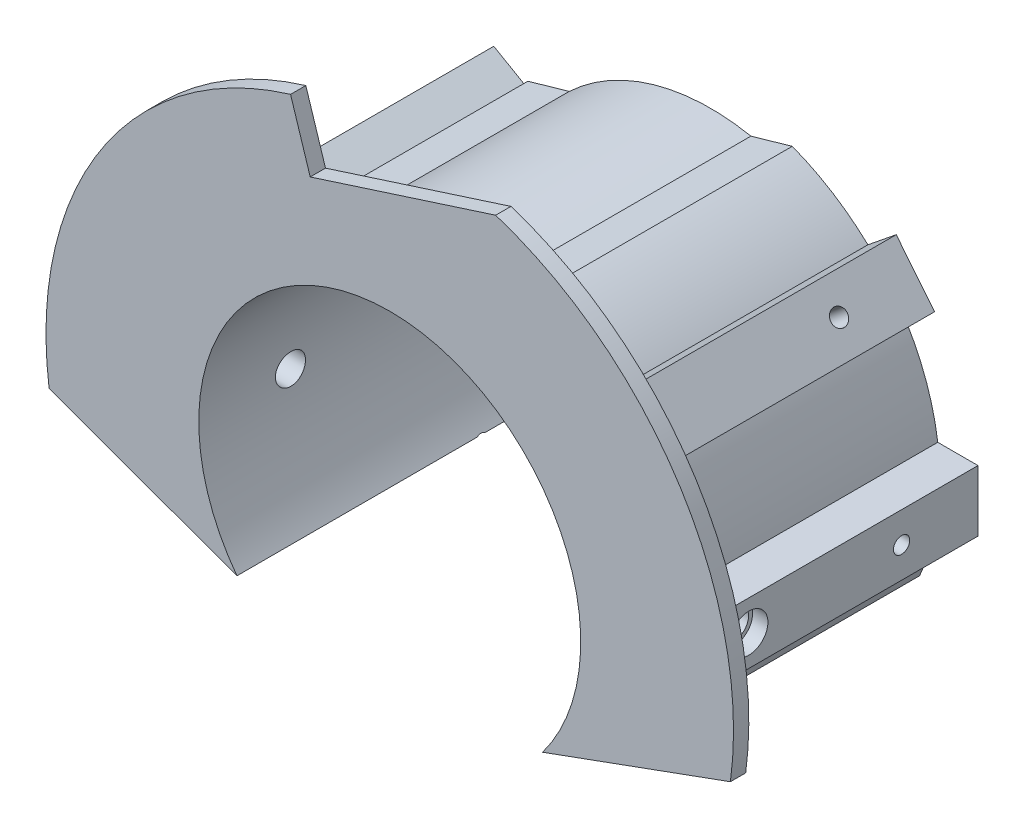
from build123d import *
from build123d.topology import SkipClean

# Parameters (mm, degrees)
BOSS_EXTRUDE1_DEPTH        = 50.8
BOSS_EXTRUDE2_START        = 34.925
SKETCH2_W                  = 50.8
SKETCH2_H                  = 10.16
BOSS_EXTRUDE2_DEPTH        = 9.525
BOSS_EXTRUDE3_START        = -34.925
SKETCH2_3_W                = 50.8
SKETCH2_3_H                = 10.16
BOSS_EXTRUDE3_DEPTH        = 9.525
F_6_32_TAPPED_HOLE1_D      = 2.7051
SKETCH7_R                  = 2.5
CUT_EXTRUDE1_DEPTH         = 110.249531019
SKETCH8_R                  = 3.175
CUT_EXTRUDE2_DEPTH         = 2.54
CUT_EXTRUDE3_START         = -86.36
SKETCH8_2_R                = 3.175
CUT_EXTRUDE3_DEPTH         = 2.54
CUT_EXTRUDE4_DEPTH         = 78.511628283
SKETCH11_W                 = 50.8
SKETCH11_H                 = 10.16
BOSS_EXTRUDE4_DEPTH        = 8.89
SKETCH12_W                 = 50.8
SKETCH12_H                 = 7.595567884
BOSS_EXTRUDE5_DEPTH        = 8.89
F_6_32_TAPPED_HOLE2_D      = 2.7051
F_6_32_TAPPED_HOLE3_REACH  = 107.105
F_6_32_TAPPED_HOLE3_BORE_R = 1.35255
BOSS_EXTRUDE6_DEPTH        = 2.54
CUT_EXTRUDE6_START         = -2.54
CUT_EXTRUDE6_DEPTH         = 2.54


# Read off the part's stored shape, not the designer's step: Cut-Extrude6
with BuildPart() as part:
    # Sketch1 → Boss-Extrude1 (new body)
    with BuildSketch(Plane.XY):
        with BuildLine():
            Line((-25.4, -19.05), (-34.736620143, -15.651748179))
            ThreePointArc((-34.736620143, -15.651748179), (0, 38.1), (34.736620143, -15.651748179))
            Line((34.736620143, -15.651748179), (25.4, -19.05))
            ThreePointArc((25.4, -19.05), (0, 31.75), (-25.4, -19.05))
        make_face()
    extrude(amount=BOSS_EXTRUDE1_DEPTH)

    # Sketch2 → Boss-Extrude2 (add)
    with BuildSketch(Plane(origin=(0, 0, 0), x_dir=(0, 0, -1), z_dir=(1, 0, 0)).offset(BOSS_EXTRUDE2_START)):
        with Locations((-25.4, 0)):
            Rectangle(SKETCH2_W, SKETCH2_H)
    extrude(amount=BOSS_EXTRUDE2_DEPTH)

    # Sketch2<3> → Boss-Extrude3 (add)
    with BuildSketch(Plane(origin=(0, 0, 0), x_dir=(0, 0, -1), z_dir=(1, 0, 0)).offset(BOSS_EXTRUDE3_START)):
        with Locations((-25.4, 0)):
            Rectangle(SKETCH2_3_W, SKETCH2_3_H)
    extrude(amount=-BOSS_EXTRUDE3_DEPTH)

    # #6-32 Tapped Hole1 (through all)
    with Locations(Plane(origin=(44.45, 0, 0), x_dir=(0, 0, -1), z_dir=(1, 0, 0))):
        with Locations((-12.7, 0)):
            Hole(F_6_32_TAPPED_HOLE1_D / 2)

    # Sketch7 → Cut-Extrude1 (cut, through all)
    with BuildSketch(Plane(origin=(44.45, 0, 0), x_dir=(0, 0, -1), z_dir=(1, 0, 0))):
        with Locations((-38.1, 0)):
            Circle(SKETCH7_R)
    extrude(amount=-CUT_EXTRUDE1_DEPTH, mode=Mode.SUBTRACT)

    # Sketch8 → Cut-Extrude2 (cut)
    with BuildSketch(Plane(origin=(44.45, 0, 0), x_dir=(0, 0, -1), z_dir=(1, 0, 0))):
        with Locations((-38.1, 0)):
            Circle(SKETCH8_R)
    extrude(amount=-CUT_EXTRUDE2_DEPTH, mode=Mode.SUBTRACT)

    # Sketch8<2> → Cut-Extrude3 (cut)
    with BuildSketch(Plane(origin=(44.45, 0, 0), x_dir=(0, 0, -1), z_dir=(1, 0, 0)).offset(CUT_EXTRUDE3_START)):
        with Locations((-38.1, 0)):
            Circle(SKETCH8_2_R)
    extrude(amount=-CUT_EXTRUDE3_DEPTH, mode=Mode.SUBTRACT)

    # Sketch9 → Cut-Extrude4 (cut, through all)
    with BuildSketch(Plane.XY.offset(50.8)):
        with BuildLine():
            Line((6.699064553, 33.629252655), (17.438088821, 36.708618311))
            ThreePointArc((17.438088821, 36.708618311), (-11.20190214, 39.065675323), (-34.240942031, 21.889894674))
            Line((-34.240942031, 21.889894674), (-23.501917764, 24.96926033))
            ThreePointArc((-23.501917764, 24.96926033), (-9.451604931, 32.961663554), (6.699064553, 33.629252655))
        make_face()
    extrude(amount=-CUT_EXTRUDE4_DEPTH, mode=Mode.SUBTRACT)

    # Sketch11 → Boss-Extrude4 (add)
    with BuildSketch(Plane(origin=(27.141822704, 21.979014657, 0), x_dir=(0, 0, -1), z_dir=(0.77714596145697, 0.6293203910498384, 0))):
        with Locations((-25.4, 0)):
            Rectangle(SKETCH11_W, SKETCH11_H)
    extrude(amount=BOSS_EXTRUDE4_DEPTH)

    # Sketch12 → Boss-Extrude5 (add)
    with BuildSketch(Plane(origin=(-30.245937227, 17.4625, 0), x_dir=(0, 0, 1), z_dir=(-0.8660254037844417, 0.4999999999999946, 0))):
        with Locations((25.4, 0)):
            Rectangle(SKETCH12_W, SKETCH12_H)
    extrude(amount=BOSS_EXTRUDE5_DEPTH)

    # #6-32 Tapped Hole2 (through all)
    with Locations(Plane(origin=(34.050650301, 27.573672934, 0), x_dir=(0, 0, -1), z_dir=(0.7771459614569701, 0.6293203910498384, 0))):
        with Locations((-12.7, 0)):
            Hole(F_6_32_TAPPED_HOLE2_D / 2)

    # #6-32 Tapped Hole3 bore → #6-32 Tapped Hole3 (cut, up to next)
    with BuildSketch(Plane(origin=(-37.944903067, 21.9075, 0), x_dir=(0, 0, 1), z_dir=(-0.8660254037844414, 0.4999999999999951, 0)), mode=Mode.PRIVATE) as f_6_32_tapped_hole3_sk1:
        with Locations((12.7, 0)):
            Circle(F_6_32_TAPPED_HOLE3_BORE_R)
    f_6_32_tapped_hole3_tool1 = extrude(f_6_32_tapped_hole3_sk1.sketch, amount=-F_6_32_TAPPED_HOLE3_REACH, mode=Mode.PRIVATE) & part.part
    add(f_6_32_tapped_hole3_tool1.solids().sort_by_distance((-37.944903, 21.9075, 12.7))[0], mode=Mode.SUBTRACT)

    # Sketch18 → Boss-Extrude6 (add)
    with SkipClean():  # the faces are left unmerged after this step: merging them gives an invalid solid
        with BuildSketch(Plane.XY.offset(50.8)):
            with BuildLine():
                Line((25.4, -19.05), (56.631243544, -7.682756971))
                ThreePointArc((56.631243544, -7.682756971), (0, 57.15), (-56.631243544, -7.682756971))
                Line((-56.631243544, -7.682756971), (-25.4, -19.05))
                ThreePointArc((-25.4, -19.05), (0, 31.75), (25.4, -19.05))
            make_face()
        extrude(amount=BOSS_EXTRUDE6_DEPTH)

    # Cut-Extrude6 outline → Cut-Extrude6 (cut)
    with SkipClean():  # the faces are left unmerged after this step: merging them gives an invalid solid
        with BuildSketch(Plane.XY.offset(53.34).offset(CUT_EXTRUDE6_START)):
            with BuildLine():
                Line((-16.491428664, 54.718874994), (-13.224275773, 44.4624488))
                Line((-13.224275773, 44.4624488), (17.608042575, 54.369838483))
                ThreePointArc((17.608042575, 54.369838483), (0.584947244, 57.147006367), (-16.491428664, 54.718874994))
            make_face()
        extrude(amount=CUT_EXTRUDE6_DEPTH, mode=Mode.SUBTRACT)


solid = part.part
